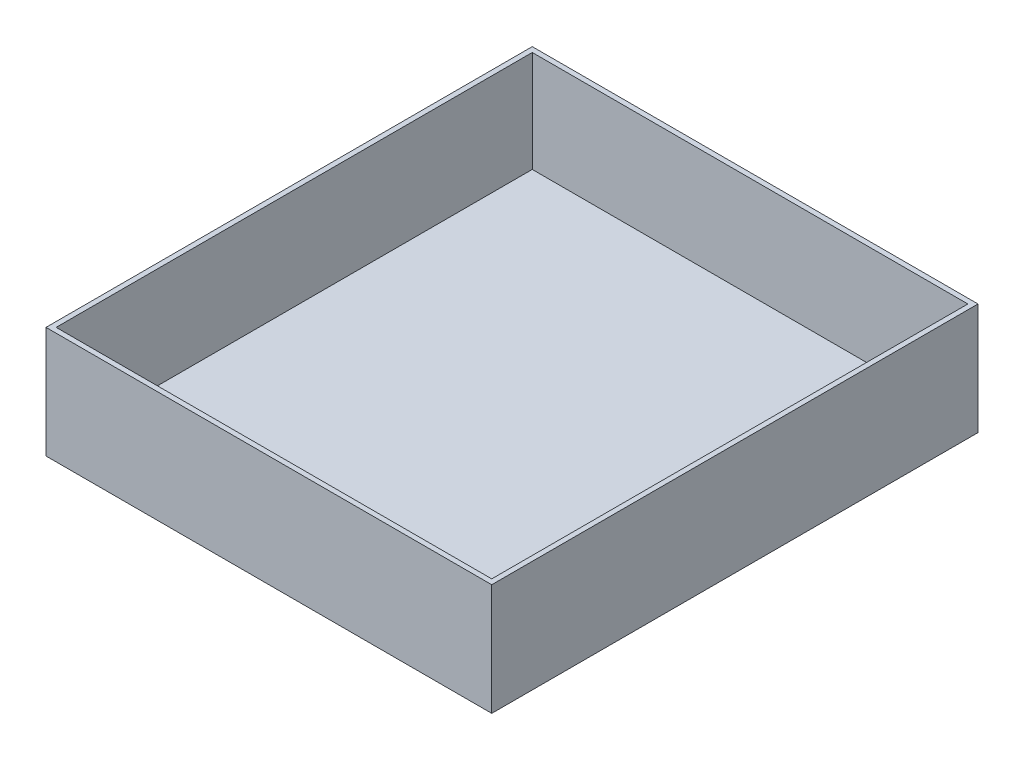
from build123d import *

# Parameters (mm, degrees)
SKETCH1_W           = 279.4
SKETCH1_H           = 304.8
BOSS_EXTRUDE1_DEPTH = 69.85
SKETCH3_W           = 273.05
SKETCH3_H           = 298.45
CUT_EXTRUDE1_DEPTH  = 63.5


with BuildPart() as part:
    # Sketch1 → Boss-Extrude1 (new body)
    with BuildSketch(Plane(origin=(0, 0, 0), x_dir=(1, 0, 0), z_dir=(0, 1, 0))):
        with Locations((139.7, 152.4)):
            Rectangle(SKETCH1_W, SKETCH1_H)
    extrude(amount=BOSS_EXTRUDE1_DEPTH)

    # Sketch3 → Cut-Extrude1 (cut)
    with BuildSketch(Plane(origin=(0, 69.85, 0), x_dir=(1, 0, 0), z_dir=(0, 1, 0))):
        with Locations((139.7, 152.4)):
            Rectangle(SKETCH3_W, SKETCH3_H)
    extrude(amount=-CUT_EXTRUDE1_DEPTH, mode=Mode.SUBTRACT)


solid = part.part
